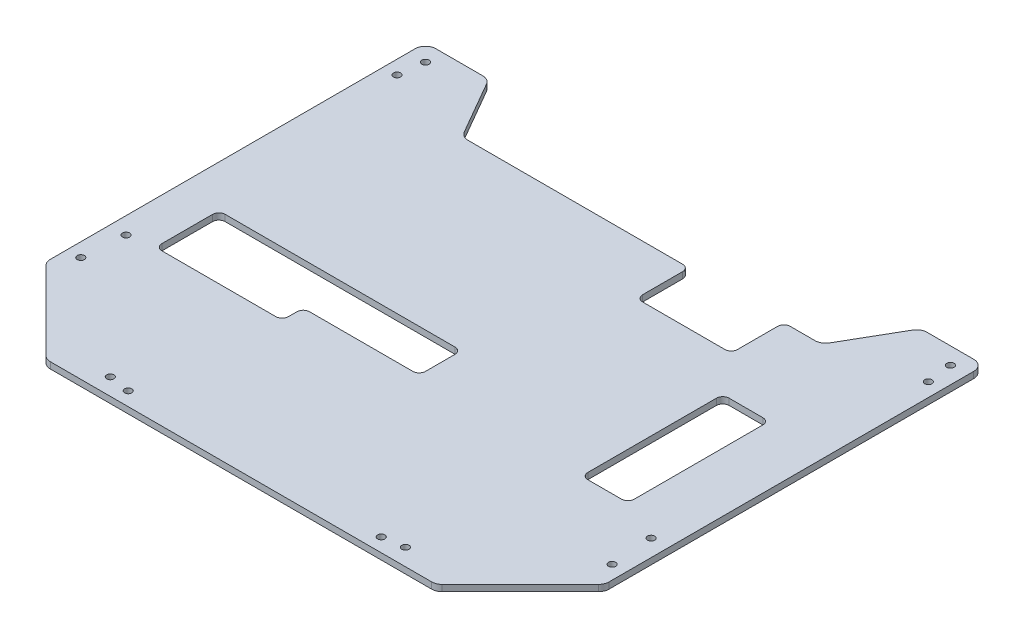
from build123d import *

# Parameters (mm, degrees)
BOSS_EXTRU_1_DEPTH      = 3
CONG_1_R                = 5
ESQUISSE2_R             = 1
ESQUISSE2_R_2           = 1.5
ENL_V_MAT_EXTRU_1_DEPTH = 257.837010573
D_GAGEMENT_M31_D        = 3.4
ESQUISSE5_W             = 45
ESQUISSE5_H             = 25
ESQUISSE5_W_2           = 22
ESQUISSE5_H_2           = 67
ENL_V_MAT_EXTRU_2_DEPTH = 257.837010573
CONG_2_R                = 3


with BuildPart() as part:
    # Esquisse1 → Boss.-Extru.1 (new body)
    with BuildSketch(Plane(origin=(0, 0, 0), x_dir=(1, 0, 0), z_dir=(0, 1, 0))):
        Polygon((-92.5, 0), (92.5, 0), (132.5, 40), (132.5, 220), (102.5, 220), (85.179491924, 190), (-85.179491924, 190), (-102.5, 220), (-132.5, 220), (-132.5, 40), align=None)
    extrude(amount=BOSS_EXTRU_1_DEPTH)

    # Congé1
    cong_1_edges = [part.edges().sort_by_distance(p)[0] for p in [
        (132.5, 1.5, -220),
        (102.5, 1.5, -220),
        (85.179491924, 1.5, -190),
        (-85.179491924, 1.5, -190),
        (-102.5, 1.5, -220),
        (-132.5, 1.5, -220),
        (-132.5, 1.5, -40),
        (-92.5, 1.5, 0),
        (92.5, 1.5, 0),
        (132.5, 1.5, -40),
    ]]
    fillet(cong_1_edges, radius=CONG_1_R)

    # Esquisse2 → Enlèv. mat.-Extru.1 (cut, through all)
    with BuildSketch(Plane.XZ):
        with Locations((-70, -8)):
            Circle(ESQUISSE2_R)
        with Locations((-124.5, -70)):
            Circle(ESQUISSE2_R)
        with Locations((-124.5, -212)):
            Circle(ESQUISSE2_R)
        with Locations((124.5, -212)):
            Circle(ESQUISSE2_R)
        with Locations((124.5, -70)):
            Circle(ESQUISSE2_R)
        with Locations((70, -8)):
            Circle(ESQUISSE2_R)
        with Locations((126, -50)):
            Circle(ESQUISSE2_R_2)
        with Locations((126, -200)):
            Circle(ESQUISSE2_R_2)
        with Locations((-60, -6.5)):
            Circle(ESQUISSE2_R_2)
        with Locations((60, -6.5)):
            Circle(ESQUISSE2_R_2)
        with Locations((-126, -50)):
            Circle(ESQUISSE2_R_2)
        with Locations((-126, -200)):
            Circle(ESQUISSE2_R_2)
    extrude(amount=-ENL_V_MAT_EXTRU_1_DEPTH, mode=Mode.SUBTRACT)

    # Dégagement M31 (through all)
    with Locations(Plane(origin=(0, 0, 0), x_dir=(-1, 0, 0), z_dir=(0, -1, 0))):
        with Locations((-70, 8), (-124.5, 70), (-124.5, 212), (124.5, 212), (124.5, 70), (70, 8), (-126, 200), (-126, 50), (-60, 6.5), (60, 6.5), (126, 200), (126, 50)):
            Hole(D_GAGEMENT_M31_D / 2)

    # Esquisse5 → Enlèv. mat.-Extru.2 (cut, through all)
    with BuildSketch(Plane.XZ):
        with Locations((45, -177.5)):
            Rectangle(ESQUISSE5_W, ESQUISSE5_H)
        Polygon((-112.5, -82), (-112.5, -72), (-52.5, -72), (-52.5, -82), (2.5, -82), (2.5, -102), (-112.5, -102), align=None)
        with Locations((93.5, -112.5)):
            Rectangle(ESQUISSE5_W_2, ESQUISSE5_H_2)
    extrude(amount=-ENL_V_MAT_EXTRU_2_DEPTH, mode=Mode.SUBTRACT)

    # Congé2
    cong_2_edges = [part.edges().sort_by_distance(p)[0] for p in [
        (67.5, 1.5, -190),
        (67.5, 1.5, -165),
        (22.5, 1.5, -165),
        (22.5, 1.5, -190),
        (104.5, 1.5, -146),
        (82.5, 1.5, -146),
        (82.5, 1.5, -79),
        (104.5, 1.5, -79),
        (2.5, 1.5, -82),
        (2.5, 1.5, -102),
        (-112.5, 1.5, -102),
        (-52.5, 1.5, -72),
        (-52.5, 1.5, -82),
        (-112.5, 1.5, -72),
    ]]
    fillet(cong_2_edges, radius=CONG_2_R)


solid = part.part
